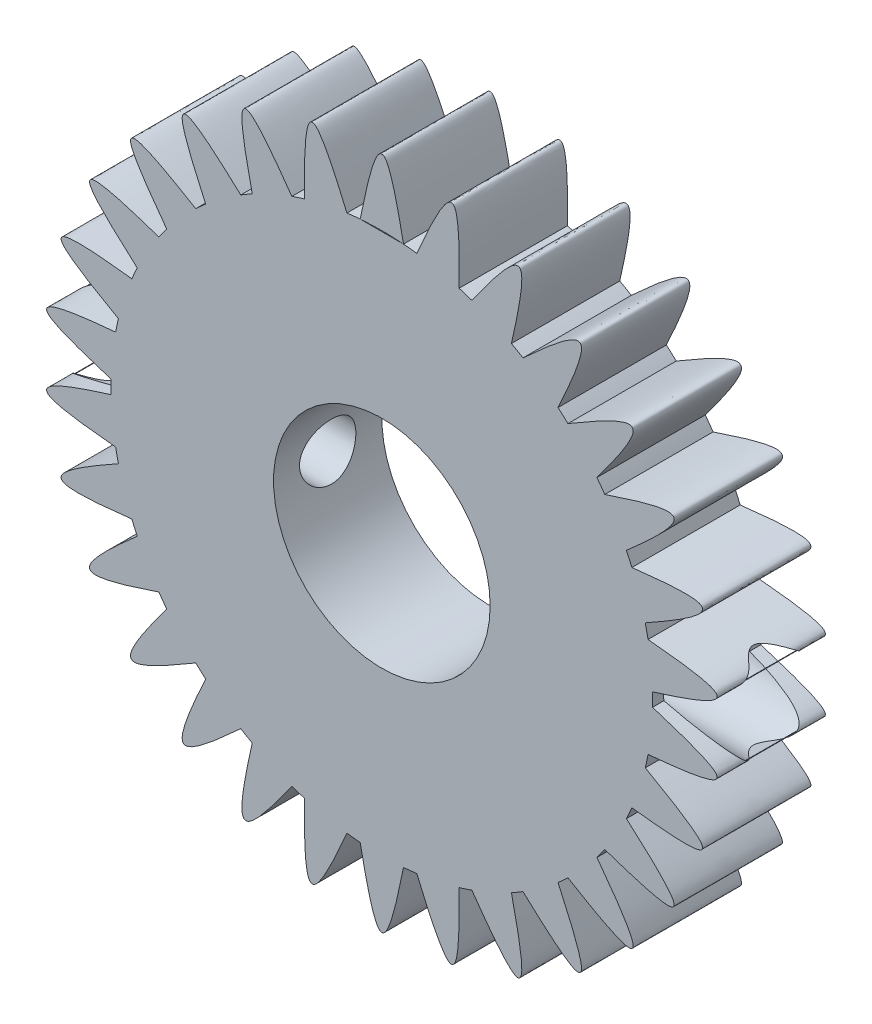
from build123d import *
from build123d.topology import SkipClean

# Parameters (mm, degrees)
BOSS_EXTRU_1_DEPTH      = 10
ESQUISSE3_R             = 4
ENL_V_MAT_EXTRU_1_DEPTH = 15
ESQUISSE6_R             = 2.6
ENL_V_MAT_EXTRU_2_DEPTH = 71.000537139


# Read off the part's stored shape, not the designer's step: Symétrie1
with BuildPart() as part:
    # Esquisse1 → Boss.-Extru.1 (new body)
    with BuildSketch(Plane.XY):
        with BuildLine():
            ThreePointArc((0, 10), (7.071067812, 7.071067812), (10, 0))
            Line((10, 0), (25, 0))
            ThreePointArc((25, 0), (24.998103641, 0.307919403), (24.992414851, 0.615792091))
            ThreePointArc((24.992414851, 0.615792091), (24.863047384, 2.613211582), (24.574300998, 4.593879673))
            ThreePointArc((24.574300998, 4.593879673), (24.453690018, 5.19779227), (24.318240248, 5.798550786))
            ThreePointArc((24.318240248, 5.798550786), (23.776412907, 7.725424859), (23.082172271, 9.602776851))
            ThreePointArc((23.082172271, 9.602776851), (22.838636441, 10.168416077), (22.581241855, 10.727884987))
            ThreePointArc((22.581241855, 10.727884987), (21.650635095, 12.5), (20.581241855, 14.191986602))
            ThreePointArc((20.581241855, 14.191986602), (20.225424859, 14.694631307), (19.857334835, 15.188359136))
            ThreePointArc((19.857334835, 15.188359136), (18.578620637, 16.728265159), (17.18081241, 18.160938438))
            ThreePointArc((17.18081241, 18.160938438), (16.728265159, 18.578620637), (16.265566998, 18.985029108))
            ThreePointArc((16.265566998, 18.985029108), (14.694631307, 20.225424859), (13.02949902, 21.336170118))
            ThreePointArc((13.02949902, 21.336170118), (12.5, 21.650635095), (11.962915831, 21.951962209))
            ThreePointArc((11.962915831, 21.951962209), (10.168416077, 22.838636441), (8.308734001, 23.578908781))
            ThreePointArc((8.308734001, 23.578908781), (7.725424859, 23.776412907), (7.137427838, 23.959489223))
            ThreePointArc((7.137427838, 23.959489223), (5.19779227, 24.453690018), (3.224837436, 24.791135987))
            ThreePointArc((3.224837436, 24.791135987), (2.613211582, 24.863047384), (2, 24.919871589))
            Line((2, 24.919871589), (0, 24.919871589))
            Line((0, 24.919871589), (0, 10))
        make_face()
        with BuildLine():
            Line((25, 0), (10, 0))
            ThreePointArc((10, 0), (-7.071067812, -7.071067812), (0, 10))
            Line((0, 10), (0, 24.919871589))
            Line((0, 24.919871589), (-2, 24.919871589))
            ThreePointArc((-2, 24.919871589), (-2.613211582, 24.863047384), (-3.224837436, 24.791135987))
            ThreePointArc((-3.224837436, 24.791135987), (-5.19779227, 24.453690018), (-7.137427838, 23.959489223))
            ThreePointArc((-7.137427838, 23.959489223), (-7.725424859, 23.776412907), (-8.308734001, 23.578908781))
            ThreePointArc((-8.308734001, 23.578908781), (-10.168416077, 22.838636441), (-11.962915831, 21.951962209))
            ThreePointArc((-11.962915831, 21.951962209), (-12.5, 21.650635095), (-13.02949902, 21.336170118))
            ThreePointArc((-13.02949902, 21.336170118), (-14.694631307, 20.225424859), (-16.265566998, 18.985029108))
            ThreePointArc((-16.265566998, 18.985029108), (-16.728265159, 18.578620637), (-17.18081241, 18.160938438))
            ThreePointArc((-17.18081241, 18.160938438), (-18.578620637, 16.728265159), (-19.857334835, 15.188359136))
            ThreePointArc((-19.857334835, 15.188359136), (-20.225424859, 14.694631307), (-20.581241855, 14.191986602))
            ThreePointArc((-20.581241855, 14.191986602), (-21.650635095, 12.5), (-22.581241855, 10.727884987))
            ThreePointArc((-22.581241855, 10.727884987), (-22.838636441, 10.168416077), (-23.082172271, 9.602776851))
            ThreePointArc((-23.082172271, 9.602776851), (-23.776412907, 7.725424859), (-24.318240248, 5.798550786))
            ThreePointArc((-24.318240248, 5.798550786), (-24.453690018, 5.19779227), (-24.574300998, 4.593879673))
            ThreePointArc((-24.574300998, 4.593879673), (-24.863047384, 2.613211582), (-24.992414851, 0.615792091))
            ThreePointArc((-24.992414851, 0.615792091), (-25, 0), (-24.992414851, -0.615792091))
            ThreePointArc((-24.992414851, -0.615792091), (-24.863047384, -2.613211582), (-24.574300998, -4.593879673))
            ThreePointArc((-24.574300998, -4.593879673), (-24.453690018, -5.19779227), (-24.318240248, -5.798550786))
            ThreePointArc((-24.318240248, -5.798550786), (-23.776412907, -7.725424859), (-23.082172271, -9.602776851))
            ThreePointArc((-23.082172271, -9.602776851), (-22.838636441, -10.168416077), (-22.581241855, -10.727884987))
            ThreePointArc((-22.581241855, -10.727884987), (-21.650635095, -12.5), (-20.581241855, -14.191986602))
            ThreePointArc((-20.581241855, -14.191986602), (-20.225424859, -14.694631307), (-19.857334835, -15.188359136))
            ThreePointArc((-19.857334835, -15.188359136), (-18.578620637, -16.728265159), (-17.18081241, -18.160938438))
            ThreePointArc((-17.18081241, -18.160938438), (-16.728265159, -18.578620637), (-16.265566998, -18.985029108))
            ThreePointArc((-16.265566998, -18.985029108), (-14.694631307, -20.225424859), (-13.02949902, -21.336170118))
            ThreePointArc((-13.02949902, -21.336170118), (-12.5, -21.650635095), (-11.962915831, -21.951962209))
            ThreePointArc((-11.962915831, -21.951962209), (-10.168416077, -22.838636441), (-8.308734001, -23.578908781))
            ThreePointArc((-8.308734001, -23.578908781), (-7.725424859, -23.776412907), (-7.137427838, -23.959489223))
            ThreePointArc((-7.137427838, -23.959489223), (-5.19779227, -24.453690018), (-3.224837436, -24.791135987))
            ThreePointArc((-3.224837436, -24.791135987), (-2.613211582, -24.863047384), (-2, -24.919871589))
            ThreePointArc((-2, -24.919871589), (0, -25), (2, -24.919871589))
            ThreePointArc((2, -24.919871589), (2.613211582, -24.863047384), (3.224837436, -24.791135987))
            ThreePointArc((3.224837436, -24.791135987), (5.19779227, -24.453690018), (7.137427838, -23.959489223))
            ThreePointArc((7.137427838, -23.959489223), (7.725424859, -23.776412907), (8.308734001, -23.578908781))
            ThreePointArc((8.308734001, -23.578908781), (10.168416077, -22.838636441), (11.962915831, -21.951962209))
            ThreePointArc((11.962915831, -21.951962209), (12.5, -21.650635095), (13.02949902, -21.336170118))
            ThreePointArc((13.02949902, -21.336170118), (14.694631307, -20.225424859), (16.265566998, -18.985029108))
            ThreePointArc((16.265566998, -18.985029108), (16.728265159, -18.578620637), (17.18081241, -18.160938438))
            ThreePointArc((17.18081241, -18.160938438), (18.578620637, -16.728265159), (19.857334835, -15.188359136))
            ThreePointArc((19.857334835, -15.188359136), (20.225424859, -14.694631307), (20.581241855, -14.191986602))
            ThreePointArc((20.581241855, -14.191986602), (21.650635095, -12.5), (22.581241855, -10.727884987))
            ThreePointArc((22.581241855, -10.727884987), (22.838636441, -10.168416077), (23.082172271, -9.602776851))
            ThreePointArc((23.082172271, -9.602776851), (23.776412907, -7.725424859), (24.318240248, -5.798550786))
            ThreePointArc((24.318240248, -5.798550786), (24.453690018, -5.19779227), (24.574300998, -4.593879673))
            ThreePointArc((24.574300998, -4.593879673), (24.863047384, -2.613211582), (24.992414851, -0.615792091))
            ThreePointArc((24.992414851, -0.615792091), (24.998103641, -0.307919403), (25, 0))
        make_face()
        with BuildLine():
            add(Edge.make_bspline(
                [(25, 0.618143566), (24.996208904, 0.616968166), (24.992414851, 0.615792091)],
                knots=[0.999758068, 0.999758068, 0.999758068, 1, 1, 1], degree=2, weights=[1.000289225, 1.000144647, 1]))
            Line((25, 0.618143566), (25, 4.554274477))
            add(Edge.make_bspline(
                [(24.574300998, 4.593879673), (24.791672143, 4.574011971), (25, 4.554274477)],
                knots=[0, 0, 0, 0.013399164, 0.013399164, 0.013399164], degree=2, weights=[1, 1.008011163, 1.01580764]))
            ThreePointArc((24.574300998, 4.593879673), (24.863047384, 2.613211582), (24.992414851, 0.615792091))
        make_face()
        with BuildLine():
            Line((25, 4.554274477), (25, 0.618143566))
            add(Edge.make_bspline(
                [(25, 4.554274477), (34.724016278, 3.632997245), (25, 0.618143566)],
                knots=[0.013399164, 0.013399164, 0.013399164, 0.999758068, 0.999758068, 0.999758068], degree=2, weights=[1.01580764, 1.589733328, 1.000289225]))
        make_face()
        with BuildLine():
            add(Edge.make_bspline(
                [(24.992414851, -0.615792091), (34.808266338, -3.658496214), (24.574300998, -4.593879673)],
                knots=[0, 0, 0, 1, 1, 1], degree=2, weights=[1, 1.597885261, 1]))
            ThreePointArc((24.992414851, -0.615792091), (24.863047384, -2.613211582), (24.574300998, -4.593879673))
        make_face()
        with BuildLine():
            ThreePointArc((-2, 24.919871589), (-1.000802248, 24.979959865), (0, 25))
            Line((0, 25), (0, 31.119871589))
            add(Edge.make_bspline(
                [(-2, 24.919871589), (-0.769856941, 31.119871589), (0, 31.119871589)],
                knots=[0, 0, 0, 0.5, 0.5, 0.5], degree=2, weights=[1, 1.298942631, 1.298942631]))
        make_face()
        with BuildLine():
            Line((0, 31.119871589), (0, 25))
            ThreePointArc((0, 25), (1.000802248, 24.979959865), (2, 24.919871589))
            add(Edge.make_bspline(
                [(0, 31.119871589), (0.769856941, 31.119871589), (2, 24.919871589)],
                knots=[0.5, 0.5, 0.5, 1, 1, 1], degree=2, weights=[1.298942631, 1.298942631, 1]))
        make_face()
        with BuildLine():
            add(Edge.make_bspline(
                [(3.224837436, 24.791135987), (7.276909179, 34.235166026), (7.137427838, 23.959489223)],
                knots=[0, 0, 0, 1, 1, 1], degree=2, weights=[1, 1.597885261, 1]))
            ThreePointArc((3.224837436, 24.791135987), (5.19779227, 24.453690018), (7.137427838, 23.959489223))
        make_face()
        with BuildLine():
            ThreePointArc((-7.137427838, 23.959489223), (-5.19779227, 24.453690018), (-3.224837436, 24.791135987))
            add(Edge.make_bspline(
                [(-7.137427838, 23.959489223), (-7.276909179, 34.235166026), (-3.224837436, 24.791135987)],
                knots=[0, 0, 0, 1, 1, 1], degree=2, weights=[1, 1.597885261, 1]))
        make_face()
        with BuildLine():
            add(Edge.make_bspline(
                [(25, 6.182683076), (24.673224833, 5.997126474), (24.318240248, 5.798550786)],
                knots=[0.974857265, 0.974857265, 0.974857265, 1, 1, 1], degree=2, weights=[1.029309026, 1.01503247, 1]))
            Line((25, 6.182683076), (25, 9.813894767))
            add(Edge.make_bspline(
                [(23.082172271, 9.602776851), (24.142312096, 9.728772057), (25, 9.813894767)],
                knots=[0, 0, 0, 0.06764432, 0.06764432, 0.06764432], degree=2, weights=[1, 1.040443542, 1.075415532]))
            ThreePointArc((23.082172271, 9.602776851), (23.776412907, 7.725424859), (24.318240248, 5.798550786))
        make_face()
        with BuildLine():
            Line((25, 9.813894767), (25, 6.182683076))
            add(Edge.make_bspline(
                [(25, 9.813894767), (32.749145823, 10.582972055), (25, 6.182683076)],
                knots=[0.06764432, 0.06764432, 0.06764432, 0.974857265, 0.974857265, 0.974857265], degree=2, weights=[1.075415532, 1.544442972, 1.029309026]))
        make_face()
        with BuildLine():
            add(Edge.make_bspline(
                [(24.318240248, -5.798550786), (33.28697807, -10.815594803), (23.082172271, -9.602776851)],
                knots=[0, 0, 0, 1, 1, 1], degree=2, weights=[1, 1.597885261, 1]))
            ThreePointArc((24.318240248, -5.798550786), (23.776412907, -7.725424859), (23.082172271, -9.602776851))
        make_face()
        with BuildLine():
            add(Edge.make_bspline(
                [(25, 15.537584395), (28.612023999, 16.383142361), (25, 12.92364436)],
                knots=[0.21309454, 0.21309454, 0.21309454, 0.870904136, 0.870904136, 0.870904136], degree=2, weights=[1.200513087, 1.426189859, 1.134440626]))
            Line((25, 15.537584395), (25, 12.92364436))
        make_face()
        with BuildLine():
            Line((25, 12.92364436), (25, 15.537584395))
            add(Edge.make_bspline(
                [(20.581241855, 14.191986602), (23.519802339, 15.191077029), (25, 15.537584395)],
                knots=[0, 0, 0, 0.21309454, 0.21309454, 0.21309454], degree=2, weights=[1, 1.127406084, 1.200513087]))
            ThreePointArc((20.581241855, 14.191986602), (21.650635095, 12.5), (22.581241855, 10.727884987))
            add(Edge.make_bspline(
                [(25, 12.92364436), (24.061466036, 12.024742145), (22.581241855, 10.727884987)],
                knots=[0.870904136, 0.870904136, 0.870904136, 1, 1, 1], degree=2, weights=[1.134440626, 1.077184514, 1]))
        make_face()
        with BuildLine():
            add(Edge.make_bspline(
                [(8.308734001, 23.578908781), (14.235782508, 31.974091017), (11.962915831, 21.951962209)],
                knots=[0, 0, 0, 1, 1, 1], degree=2, weights=[1, 1.597885261, 1]))
            ThreePointArc((8.308734001, 23.578908781), (10.168416077, 22.838636441), (11.962915831, 21.951962209))
        make_face()
        with BuildLine():
            ThreePointArc((-11.962915831, 21.951962209), (-10.168416077, 22.838636441), (-8.308734001, 23.578908781))
            add(Edge.make_bspline(
                [(-11.962915831, 21.951962209), (-14.235782508, 31.974091017), (-8.308734001, 23.578908781)],
                knots=[0, 0, 0, 1, 1, 1], degree=2, weights=[1, 1.597885261, 1]))
        make_face()
        with BuildLine():
            add(Edge.make_bspline(
                [(22.581241855, -10.727884987), (30.310889132, -17.5), (20.581241855, -14.191986602)],
                knots=[0, 0, 0, 1, 1, 1], degree=2, weights=[1, 1.597885261, 1]))
            ThreePointArc((22.581241855, -10.727884987), (21.650635095, -12.5), (20.581241855, -14.191986602))
        make_face()
        with BuildLine():
            ThreePointArc((17.18081241, 18.160938438), (18.578620637, 16.728265159), (19.857334835, 15.188359136))
            add(Edge.make_bspline(
                [(17.18081241, 18.160938438), (26.010068892, 23.419571223), (19.857334835, 15.188359136)],
                knots=[0, 0, 0, 1, 1, 1], degree=2, weights=[1, 1.597885261, 1]))
        make_face()
        with BuildLine():
            add(Edge.make_bspline(
                [(13.02949902, 21.336170118), (20.57248383, 28.315594803), (16.265566998, 18.985029108)],
                knots=[0, 0, 0, 1, 1, 1], degree=2, weights=[1, 1.597885261, 1]))
            ThreePointArc((13.02949902, 21.336170118), (14.694631307, 20.225424859), (16.265566998, 18.985029108))
        make_face()
        with BuildLine():
            ThreePointArc((-16.265566998, 18.985029108), (-14.694631307, 20.225424859), (-13.02949902, 21.336170118))
            add(Edge.make_bspline(
                [(-16.265566998, 18.985029108), (-20.57248383, 28.315594803), (-13.02949902, 21.336170118)],
                knots=[0, 0, 0, 1, 1, 1], degree=2, weights=[1, 1.597885261, 1]))
        make_face()
        with BuildLine():
            add(Edge.make_bspline(
                [(19.857334835, -15.188359136), (26.010068892, -23.419571223), (17.18081241, -18.160938438)],
                knots=[0, 0, 0, 1, 1, 1], degree=2, weights=[1, 1.597885261, 1]))
            ThreePointArc((19.857334835, -15.188359136), (18.578620637, -16.728265159), (17.18081241, -18.160938438))
        make_face()
        with BuildLine():
            ThreePointArc((-19.857334835, 15.188359136), (-18.578620637, 16.728265159), (-17.18081241, 18.160938438))
            add(Edge.make_bspline(
                [(-19.857334835, 15.188359136), (-26.010068892, 23.419571223), (-17.18081241, 18.160938438)],
                knots=[0, 0, 0, 1, 1, 1], degree=2, weights=[1, 1.597885261, 1]))
        make_face()
        with BuildLine():
            add(Edge.make_bspline(
                [(16.265566998, -18.985029108), (20.57248383, -28.315594803), (13.02949902, -21.336170118)],
                knots=[0, 0, 0, 1, 1, 1], degree=2, weights=[1, 1.597885261, 1]))
            ThreePointArc((16.265566998, -18.985029108), (14.694631307, -20.225424859), (13.02949902, -21.336170118))
        make_face()
        with BuildLine():
            ThreePointArc((-22.581241855, 10.727884987), (-21.650635095, 12.5), (-20.581241855, 14.191986602))
            add(Edge.make_bspline(
                [(-22.581241855, 10.727884987), (-30.310889132, 17.5), (-20.581241855, 14.191986602)],
                knots=[0, 0, 0, 1, 1, 1], degree=2, weights=[1, 1.597885261, 1]))
        make_face()
        with BuildLine():
            add(Edge.make_bspline(
                [(11.962915831, -21.951962209), (14.235782508, -31.974091017), (8.308734001, -23.578908781)],
                knots=[0, 0, 0, 1, 1, 1], degree=2, weights=[1, 1.597885261, 1]))
            ThreePointArc((11.962915831, -21.951962209), (10.168416077, -22.838636441), (8.308734001, -23.578908781))
        make_face()
        with BuildLine():
            ThreePointArc((-24.318240248, 5.798550786), (-23.776412907, 7.725424859), (-23.082172271, 9.602776851))
            add(Edge.make_bspline(
                [(-24.318240248, 5.798550786), (-33.28697807, 10.815594803), (-23.082172271, 9.602776851)],
                knots=[0, 0, 0, 1, 1, 1], degree=2, weights=[1, 1.597885261, 1]))
        make_face()
        with BuildLine():
            add(Edge.make_bspline(
                [(7.137427838, -23.959489223), (7.276909179, -34.235166026), (3.224837436, -24.791135987)],
                knots=[0, 0, 0, 1, 1, 1], degree=2, weights=[1, 1.597885261, 1]))
            ThreePointArc((7.137427838, -23.959489223), (5.19779227, -24.453690018), (3.224837436, -24.791135987))
        make_face()
        with BuildLine():
            ThreePointArc((-24.992414851, 0.615792091), (-24.863047384, 2.613211582), (-24.574300998, 4.593879673))
            add(Edge.make_bspline(
                [(-24.992414851, 0.615792091), (-34.808266338, 3.658496214), (-24.574300998, 4.593879673)],
                knots=[0, 0, 0, 1, 1, 1], degree=2, weights=[1, 1.597885261, 1]))
        make_face()
        with BuildLine():
            add(Edge.make_bspline(
                [(2, -24.919871589), (0, -35), (-2, -24.919871589)],
                knots=[0, 0, 0, 1, 1, 1], degree=2, weights=[1, 1.597885261, 1]))
            ThreePointArc((2, -24.919871589), (0, -25), (-2, -24.919871589))
        make_face()
        with BuildLine():
            ThreePointArc((-24.574300998, -4.593879673), (-24.863047384, -2.613211582), (-24.992414851, -0.615792091))
            add(Edge.make_bspline(
                [(-24.574300998, -4.593879673), (-34.808266338, -3.658496214), (-24.992414851, -0.615792091)],
                knots=[0, 0, 0, 1, 1, 1], degree=2, weights=[1, 1.597885261, 1]))
        make_face()
        with BuildLine():
            add(Edge.make_bspline(
                [(-3.224837436, -24.791135987), (-7.276909179, -34.235166026), (-7.137427838, -23.959489223)],
                knots=[0, 0, 0, 1, 1, 1], degree=2, weights=[1, 1.597885261, 1]))
            ThreePointArc((-3.224837436, -24.791135987), (-5.19779227, -24.453690018), (-7.137427838, -23.959489223))
        make_face()
        with BuildLine():
            ThreePointArc((-23.082172271, -9.602776851), (-23.776412907, -7.725424859), (-24.318240248, -5.798550786))
            add(Edge.make_bspline(
                [(-23.082172271, -9.602776851), (-33.28697807, -10.815594803), (-24.318240248, -5.798550786)],
                knots=[0, 0, 0, 1, 1, 1], degree=2, weights=[1, 1.597885261, 1]))
        make_face()
        with BuildLine():
            add(Edge.make_bspline(
                [(-8.308734001, -23.578908781), (-14.235782508, -31.974091017), (-11.962915831, -21.951962209)],
                knots=[0, 0, 0, 1, 1, 1], degree=2, weights=[1, 1.597885261, 1]))
            ThreePointArc((-8.308734001, -23.578908781), (-10.168416077, -22.838636441), (-11.962915831, -21.951962209))
        make_face()
        with BuildLine():
            ThreePointArc((-20.581241855, -14.191986602), (-21.650635095, -12.5), (-22.581241855, -10.727884987))
            add(Edge.make_bspline(
                [(-20.581241855, -14.191986602), (-30.310889132, -17.5), (-22.581241855, -10.727884987)],
                knots=[0, 0, 0, 1, 1, 1], degree=2, weights=[1, 1.597885261, 1]))
        make_face()
        with BuildLine():
            add(Edge.make_bspline(
                [(-13.02949902, -21.336170118), (-20.57248383, -28.315594803), (-16.265566998, -18.985029108)],
                knots=[0, 0, 0, 1, 1, 1], degree=2, weights=[1, 1.597885261, 1]))
            ThreePointArc((-13.02949902, -21.336170118), (-14.694631307, -20.225424859), (-16.265566998, -18.985029108))
        make_face()
        with BuildLine():
            ThreePointArc((-17.18081241, -18.160938438), (-18.578620637, -16.728265159), (-19.857334835, -15.188359136))
            add(Edge.make_bspline(
                [(-17.18081241, -18.160938438), (-26.010068892, -23.419571223), (-19.857334835, -15.188359136)],
                knots=[0, 0, 0, 1, 1, 1], degree=2, weights=[1, 1.597885261, 1]))
        make_face()
    extrude(amount=BOSS_EXTRU_1_DEPTH)

    # Esquisse3 → Enlèv. mat.-Extru.1 (cut)
    with BuildSketch(Plane(origin=(30.949393676, 0, 0), x_dir=(0, 0, -1), z_dir=(1, 0, 0))):
        with Locations((-5, 0)):
            Circle(ESQUISSE3_R)
    extrude(amount=-ENL_V_MAT_EXTRU_1_DEPTH, mode=Mode.SUBTRACT)

    # Symétrie1
    split(bisect_by=Plane(origin=(0, 0, 0), x_dir=(0, 0, 1), z_dir=(1, 0, 0)), keep=Keep.TOP)

    # Sym_trie1 2: part across plane


with BuildPart() as part_1:
    with SkipClean():  # the faces are left unmerged after this step: merging them gives an invalid solid
        add(part.part)
        add(part.part.mirror(Plane(origin=(0, 0, 0), x_dir=(0, 0, 1), z_dir=(1, 0, 0))))

    # Esquisse6 → Enlèv. mat.-Extru.2 (cut, through all)
    with SkipClean():  # the faces are left unmerged after this step: merging them gives an invalid solid
        with BuildSketch(Plane(origin=(30.949393676, 0, 0), x_dir=(0, 0, -1), z_dir=(1, 0, 0))):
            with Locations(Location((-5, 0, 0), (0, 0, 180))):
                Circle(ESQUISSE6_R)
        extrude(amount=-ENL_V_MAT_EXTRU_2_DEPTH, mode=Mode.SUBTRACT)


solid = part_1.part
